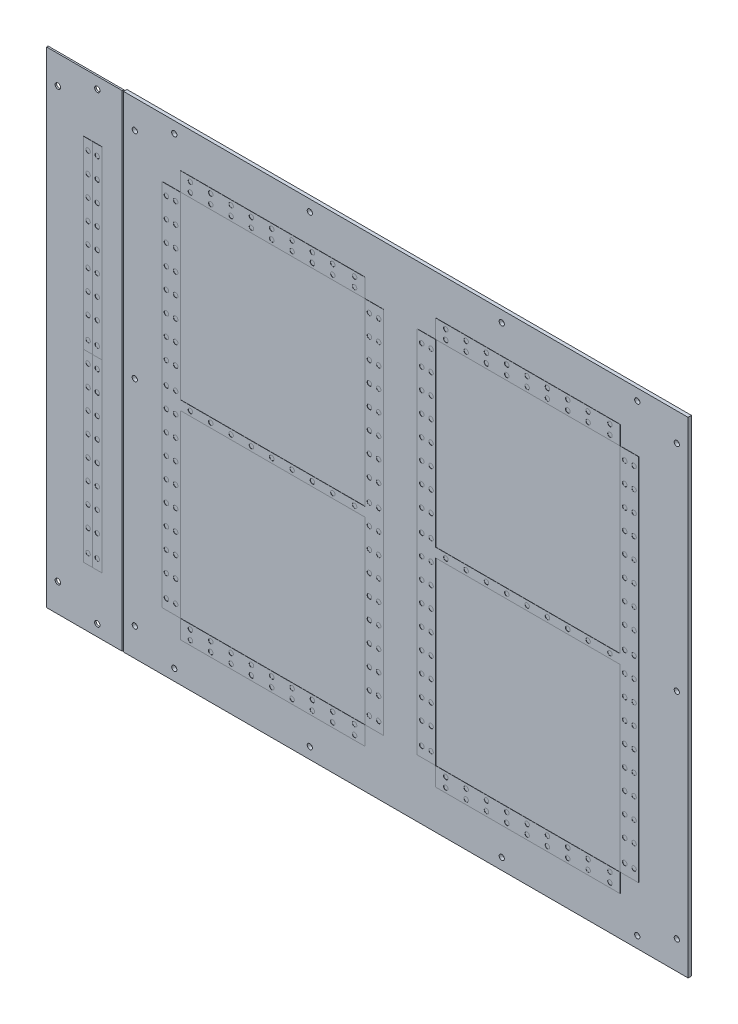
from build123d import *

# Parameters (mm, degrees)
ESBO_O4_W                        = 500
ESBO_O4_H                        = 430
FLANGE_BASE1_DEPTH               = 3
ESBO_O6_W                        = 67
ESBO_O6_H                        = 430
FLANGE_BASE2_DEPTH               = 1.4
ESBO_O9_R                        = 2.4
CORTE_EXTRUS_O2_DEPTH            = 10
RESSALTO_EXTRUS_O1_OUTLINE_W     = 8.2
RESSALTO_EXTRUS_O1_OUTLINE_H     = 163.357552272
RESSALTO_EXTRUS_O1_OUTLINE_R     = 2
RESSALTO_EXTRUS_O1_DEPTH         = 0.2
RESSALTO_EXTRUS_O1_2_OUTLINE_W   = 8.2
RESSALTO_EXTRUS_O1_2_OUTLINE_H   = 163.357552271
RESSALTO_EXTRUS_O1_2_OUTLINE_R   = 2
RESSALTO_EXTRUS_O1_2_DEPTH       = 0.2
RESSALTO_EXTRUS_O1_3_OUTLINE_W   = 8.2
RESSALTO_EXTRUS_O1_3_OUTLINE_H   = 163.357552271
RESSALTO_EXTRUS_O1_3_OUTLINE_R   = 2
RESSALTO_EXTRUS_O1_3_DEPTH       = 0.2
RESSALTO_EXTRUS_O1_4_OUTLINE_W   = 8.2
RESSALTO_EXTRUS_O1_4_OUTLINE_H   = 163.357552272
RESSALTO_EXTRUS_O1_4_OUTLINE_R   = 2
RESSALTO_EXTRUS_O1_4_DEPTH       = 0.2
RESSALTO_EXTRUS_O1_5_OUTLINE_W   = 163.357552272
RESSALTO_EXTRUS_O1_5_OUTLINE_H   = 16.4
RESSALTO_EXTRUS_O1_5_OUTLINE_R   = 2
RESSALTO_EXTRUS_O1_5_OUTLINE_W_2 = 163.357552271
RESSALTO_EXTRUS_O1_5_DEPTH       = 0.2
ESBO_O13_R                       = 2.3
CORTE_EXTRUS_O3_DEPTH            = 3


with BuildPart() as part:
    # Flange-base1: sheet metal written as solids
    # Esboço4 → Flange-base1 (new body)
    with BuildSketch(Plane.XY):
        with Locations((39.157455037, 0)):
            Rectangle(ESBO_O4_W, ESBO_O4_H)
    extrude(amount=-FLANGE_BASE1_DEPTH)

    # Ressalto-extrus_o1 5 outline → Ressalto-extrus_o1 5 (add)
    # profile 1 of 6: a face of its own
    with BuildSketch(Plane.XY):
        with Locations((-78.655821477, -171.990181002)):
            Rectangle(RESSALTO_EXTRUS_O1_5_OUTLINE_W, RESSALTO_EXTRUS_O1_5_OUTLINE_H)
        with Locations((-151.334597613, -176.090181002)):
            Circle(RESSALTO_EXTRUS_O1_5_OUTLINE_R, mode=Mode.SUBTRACT)
        with Locations((-151.334597613, -167.890181002)):
            Circle(RESSALTO_EXTRUS_O1_5_OUTLINE_R, mode=Mode.SUBTRACT)
        with Locations((-133.334597613, -176.090181002)):
            Circle(RESSALTO_EXTRUS_O1_5_OUTLINE_R, mode=Mode.SUBTRACT)
        with Locations((-133.334597613, -167.890181002)):
            Circle(RESSALTO_EXTRUS_O1_5_OUTLINE_R, mode=Mode.SUBTRACT)
        with Locations((-115.334597613, -176.090181002)):
            Circle(RESSALTO_EXTRUS_O1_5_OUTLINE_R, mode=Mode.SUBTRACT)
        with Locations((-115.334597613, -167.890181002)):
            Circle(RESSALTO_EXTRUS_O1_5_OUTLINE_R, mode=Mode.SUBTRACT)
        with Locations((-97.334597613, -176.090181002)):
            Circle(RESSALTO_EXTRUS_O1_5_OUTLINE_R, mode=Mode.SUBTRACT)
        with Locations((-79.334597613, -176.090181002)):
            Circle(RESSALTO_EXTRUS_O1_5_OUTLINE_R, mode=Mode.SUBTRACT)
        with Locations((-97.334597613, -167.890181002)):
            Circle(RESSALTO_EXTRUS_O1_5_OUTLINE_R, mode=Mode.SUBTRACT)
        with Locations((-79.334597613, -167.890181002)):
            Circle(RESSALTO_EXTRUS_O1_5_OUTLINE_R, mode=Mode.SUBTRACT)
        with Locations((-61.334597613, -176.090181002)):
            Circle(RESSALTO_EXTRUS_O1_5_OUTLINE_R, mode=Mode.SUBTRACT)
        with Locations((-61.334597613, -167.890181002)):
            Circle(RESSALTO_EXTRUS_O1_5_OUTLINE_R, mode=Mode.SUBTRACT)
        with Locations((-43.334597613, -176.090181002)):
            Circle(RESSALTO_EXTRUS_O1_5_OUTLINE_R, mode=Mode.SUBTRACT)
        with Locations((-25.334597613, -176.090181002)):
            Circle(RESSALTO_EXTRUS_O1_5_OUTLINE_R, mode=Mode.SUBTRACT)
        with Locations((-43.334597613, -167.890181002)):
            Circle(RESSALTO_EXTRUS_O1_5_OUTLINE_R, mode=Mode.SUBTRACT)
        with Locations((-25.334597613, -167.890181002)):
            Circle(RESSALTO_EXTRUS_O1_5_OUTLINE_R, mode=Mode.SUBTRACT)
        with Locations((-5.977045341, -176.090181002)):
            Circle(RESSALTO_EXTRUS_O1_5_OUTLINE_R, mode=Mode.SUBTRACT)
        with Locations((-5.977045341, -167.890181002)):
            Circle(RESSALTO_EXTRUS_O1_5_OUTLINE_R, mode=Mode.SUBTRACT)
    # profile 2 of 6: a face of its own
    with BuildSketch(Plane.XY):
        with Locations((147.501730795, -171.990181002)):
            Rectangle(RESSALTO_EXTRUS_O1_5_OUTLINE_W_2, RESSALTO_EXTRUS_O1_5_OUTLINE_H)
        with Locations((74.822954659, -176.090181002)):
            Circle(RESSALTO_EXTRUS_O1_5_OUTLINE_R, mode=Mode.SUBTRACT)
        with Locations((74.822954659, -167.890181002)):
            Circle(RESSALTO_EXTRUS_O1_5_OUTLINE_R, mode=Mode.SUBTRACT)
        with Locations((92.822954659, -176.090181002)):
            Circle(RESSALTO_EXTRUS_O1_5_OUTLINE_R, mode=Mode.SUBTRACT)
        with Locations((110.822954659, -176.090181002)):
            Circle(RESSALTO_EXTRUS_O1_5_OUTLINE_R, mode=Mode.SUBTRACT)
        with Locations((92.822954659, -167.890181002)):
            Circle(RESSALTO_EXTRUS_O1_5_OUTLINE_R, mode=Mode.SUBTRACT)
        with Locations((110.822954659, -167.890181002)):
            Circle(RESSALTO_EXTRUS_O1_5_OUTLINE_R, mode=Mode.SUBTRACT)
        with Locations((128.822954659, -176.090181002)):
            Circle(RESSALTO_EXTRUS_O1_5_OUTLINE_R, mode=Mode.SUBTRACT)
        with Locations((128.822954659, -167.890181002)):
            Circle(RESSALTO_EXTRUS_O1_5_OUTLINE_R, mode=Mode.SUBTRACT)
        with Locations((146.822954659, -176.090181002)):
            Circle(RESSALTO_EXTRUS_O1_5_OUTLINE_R, mode=Mode.SUBTRACT)
        with Locations((164.822954659, -176.090181002)):
            Circle(RESSALTO_EXTRUS_O1_5_OUTLINE_R, mode=Mode.SUBTRACT)
        with Locations((146.822954659, -167.890181002)):
            Circle(RESSALTO_EXTRUS_O1_5_OUTLINE_R, mode=Mode.SUBTRACT)
        with Locations((164.822954659, -167.890181002)):
            Circle(RESSALTO_EXTRUS_O1_5_OUTLINE_R, mode=Mode.SUBTRACT)
        with Locations((182.822954659, -176.090181002)):
            Circle(RESSALTO_EXTRUS_O1_5_OUTLINE_R, mode=Mode.SUBTRACT)
        with Locations((182.822954659, -167.890181002)):
            Circle(RESSALTO_EXTRUS_O1_5_OUTLINE_R, mode=Mode.SUBTRACT)
        with Locations((200.822954659, -176.090181002)):
            Circle(RESSALTO_EXTRUS_O1_5_OUTLINE_R, mode=Mode.SUBTRACT)
        with Locations((200.822954659, -167.890181002)):
            Circle(RESSALTO_EXTRUS_O1_5_OUTLINE_R, mode=Mode.SUBTRACT)
        with Locations((220.18050693, -176.090181002)):
            Circle(RESSALTO_EXTRUS_O1_5_OUTLINE_R, mode=Mode.SUBTRACT)
        with Locations((220.18050693, -167.890181002)):
            Circle(RESSALTO_EXTRUS_O1_5_OUTLINE_R, mode=Mode.SUBTRACT)
    # profile 3 of 6: a face of its own
    with BuildSketch(Plane.XY):
        Polygon((3.022954659, 3.787927443), (-160.334597613, 3.787927443), (-160.334597613, 163.045479714), (-176.734597613, 163.045479714), (-176.734597613, -163.669624829), (-160.334597613, -163.669624829), (-160.334597613, -4.412072557), (3.022954659, -4.412072557), (3.022954659, -163.669624829), (19.422954659, -163.669624829), (19.422954659, 163.045479714), (3.022954659, 163.045479714), align=None)
        with Locations((-172.634597613, -154.669624829)):
            Circle(RESSALTO_EXTRUS_O1_5_OUTLINE_R, mode=Mode.SUBTRACT)
        with Locations((-164.434597613, -154.669624829)):
            Circle(RESSALTO_EXTRUS_O1_5_OUTLINE_R, mode=Mode.SUBTRACT)
        with Locations((-172.634597613, -135.312072557)):
            Circle(RESSALTO_EXTRUS_O1_5_OUTLINE_R, mode=Mode.SUBTRACT)
        with Locations((-164.434597613, -135.312072557)):
            Circle(RESSALTO_EXTRUS_O1_5_OUTLINE_R, mode=Mode.SUBTRACT)
        with Locations((-172.634597613, -117.312072557)):
            Circle(RESSALTO_EXTRUS_O1_5_OUTLINE_R, mode=Mode.SUBTRACT)
        with Locations((-164.434597613, -117.312072557)):
            Circle(RESSALTO_EXTRUS_O1_5_OUTLINE_R, mode=Mode.SUBTRACT)
        with Locations((-172.634597613, -99.312072557)):
            Circle(RESSALTO_EXTRUS_O1_5_OUTLINE_R, mode=Mode.SUBTRACT)
        with Locations((-164.434597613, -99.312072557)):
            Circle(RESSALTO_EXTRUS_O1_5_OUTLINE_R, mode=Mode.SUBTRACT)
        with Locations((7.122954659, -154.669624829)):
            Circle(RESSALTO_EXTRUS_O1_5_OUTLINE_R, mode=Mode.SUBTRACT)
        with Locations((7.122954659, -135.312072557)):
            Circle(RESSALTO_EXTRUS_O1_5_OUTLINE_R, mode=Mode.SUBTRACT)
        with Locations((15.322954659, -154.669624829)):
            Circle(RESSALTO_EXTRUS_O1_5_OUTLINE_R, mode=Mode.SUBTRACT)
        with Locations((15.322954659, -135.312072557)):
            Circle(RESSALTO_EXTRUS_O1_5_OUTLINE_R, mode=Mode.SUBTRACT)
        with Locations((7.122954659, -117.312072557)):
            Circle(RESSALTO_EXTRUS_O1_5_OUTLINE_R, mode=Mode.SUBTRACT)
        with Locations((15.322954659, -117.312072557)):
            Circle(RESSALTO_EXTRUS_O1_5_OUTLINE_R, mode=Mode.SUBTRACT)
        with Locations((7.122954659, -99.312072557)):
            Circle(RESSALTO_EXTRUS_O1_5_OUTLINE_R, mode=Mode.SUBTRACT)
        with Locations((15.322954659, -99.312072557)):
            Circle(RESSALTO_EXTRUS_O1_5_OUTLINE_R, mode=Mode.SUBTRACT)
        with Locations((-172.634597613, -81.312072557)):
            Circle(RESSALTO_EXTRUS_O1_5_OUTLINE_R, mode=Mode.SUBTRACT)
        with Locations((-164.434597613, -81.312072557)):
            Circle(RESSALTO_EXTRUS_O1_5_OUTLINE_R, mode=Mode.SUBTRACT)
        with Locations((-172.634597613, -63.312072557)):
            Circle(RESSALTO_EXTRUS_O1_5_OUTLINE_R, mode=Mode.SUBTRACT)
        with Locations((-164.434597613, -63.312072557)):
            Circle(RESSALTO_EXTRUS_O1_5_OUTLINE_R, mode=Mode.SUBTRACT)
        with Locations((-172.634597613, -45.312072557)):
            Circle(RESSALTO_EXTRUS_O1_5_OUTLINE_R, mode=Mode.SUBTRACT)
        with Locations((-164.434597613, -45.312072557)):
            Circle(RESSALTO_EXTRUS_O1_5_OUTLINE_R, mode=Mode.SUBTRACT)
        with Locations((-172.634597613, -27.312072557)):
            Circle(RESSALTO_EXTRUS_O1_5_OUTLINE_R, mode=Mode.SUBTRACT)
        with Locations((-164.434597613, -27.312072557)):
            Circle(RESSALTO_EXTRUS_O1_5_OUTLINE_R, mode=Mode.SUBTRACT)
        with Locations((-172.634597613, -9.312072557)):
            Circle(RESSALTO_EXTRUS_O1_5_OUTLINE_R, mode=Mode.SUBTRACT)
        with Locations((-164.434597613, -9.312072557)):
            Circle(RESSALTO_EXTRUS_O1_5_OUTLINE_R, mode=Mode.SUBTRACT)
        with Locations((-151.334597613, -0.312072557)):
            Circle(RESSALTO_EXTRUS_O1_5_OUTLINE_R, mode=Mode.SUBTRACT)
        with Locations((-133.334597613, -0.312072557)):
            Circle(RESSALTO_EXTRUS_O1_5_OUTLINE_R, mode=Mode.SUBTRACT)
        with Locations((-115.334597613, -0.312072557)):
            Circle(RESSALTO_EXTRUS_O1_5_OUTLINE_R, mode=Mode.SUBTRACT)
        with Locations((-97.334597613, -0.312072557)):
            Circle(RESSALTO_EXTRUS_O1_5_OUTLINE_R, mode=Mode.SUBTRACT)
        with Locations((-79.334597613, -0.312072557)):
            Circle(RESSALTO_EXTRUS_O1_5_OUTLINE_R, mode=Mode.SUBTRACT)
        with Locations((7.122954659, -81.312072557)):
            Circle(RESSALTO_EXTRUS_O1_5_OUTLINE_R, mode=Mode.SUBTRACT)
        with Locations((15.322954659, -81.312072557)):
            Circle(RESSALTO_EXTRUS_O1_5_OUTLINE_R, mode=Mode.SUBTRACT)
        with Locations((7.122954659, -63.312072557)):
            Circle(RESSALTO_EXTRUS_O1_5_OUTLINE_R, mode=Mode.SUBTRACT)
        with Locations((7.122954659, -45.312072557)):
            Circle(RESSALTO_EXTRUS_O1_5_OUTLINE_R, mode=Mode.SUBTRACT)
        with Locations((15.322954659, -63.312072557)):
            Circle(RESSALTO_EXTRUS_O1_5_OUTLINE_R, mode=Mode.SUBTRACT)
        with Locations((15.322954659, -45.312072557)):
            Circle(RESSALTO_EXTRUS_O1_5_OUTLINE_R, mode=Mode.SUBTRACT)
        with Locations((-61.334597613, -0.312072557)):
            Circle(RESSALTO_EXTRUS_O1_5_OUTLINE_R, mode=Mode.SUBTRACT)
        with Locations((-43.334597613, -0.312072557)):
            Circle(RESSALTO_EXTRUS_O1_5_OUTLINE_R, mode=Mode.SUBTRACT)
        with Locations((-25.334597613, -0.312072557)):
            Circle(RESSALTO_EXTRUS_O1_5_OUTLINE_R, mode=Mode.SUBTRACT)
        with Locations((7.122954659, -27.312072557)):
            Circle(RESSALTO_EXTRUS_O1_5_OUTLINE_R, mode=Mode.SUBTRACT)
        with Locations((15.322954659, -27.312072557)):
            Circle(RESSALTO_EXTRUS_O1_5_OUTLINE_R, mode=Mode.SUBTRACT)
        with Locations((-5.977045341, -0.312072557)):
            Circle(RESSALTO_EXTRUS_O1_5_OUTLINE_R, mode=Mode.SUBTRACT)
        with Locations((7.122954659, -9.312072557)):
            Circle(RESSALTO_EXTRUS_O1_5_OUTLINE_R, mode=Mode.SUBTRACT)
        with Locations((15.322954659, -9.312072557)):
            Circle(RESSALTO_EXTRUS_O1_5_OUTLINE_R, mode=Mode.SUBTRACT)
        with Locations((-172.634597613, 8.687927443)):
            Circle(RESSALTO_EXTRUS_O1_5_OUTLINE_R, mode=Mode.SUBTRACT)
        with Locations((-164.434597613, 8.687927443)):
            Circle(RESSALTO_EXTRUS_O1_5_OUTLINE_R, mode=Mode.SUBTRACT)
        with Locations((-172.634597613, 28.045479714)):
            Circle(RESSALTO_EXTRUS_O1_5_OUTLINE_R, mode=Mode.SUBTRACT)
        with Locations((-164.434597613, 28.045479714)):
            Circle(RESSALTO_EXTRUS_O1_5_OUTLINE_R, mode=Mode.SUBTRACT)
        with Locations((-172.634597613, 46.045479714)):
            Circle(RESSALTO_EXTRUS_O1_5_OUTLINE_R, mode=Mode.SUBTRACT)
        with Locations((-164.434597613, 46.045479714)):
            Circle(RESSALTO_EXTRUS_O1_5_OUTLINE_R, mode=Mode.SUBTRACT)
        with Locations((-172.634597613, 64.045479714)):
            Circle(RESSALTO_EXTRUS_O1_5_OUTLINE_R, mode=Mode.SUBTRACT)
        with Locations((-164.434597613, 64.045479714)):
            Circle(RESSALTO_EXTRUS_O1_5_OUTLINE_R, mode=Mode.SUBTRACT)
        with Locations((-172.634597613, 82.045479714)):
            Circle(RESSALTO_EXTRUS_O1_5_OUTLINE_R, mode=Mode.SUBTRACT)
        with Locations((-164.434597613, 82.045479714)):
            Circle(RESSALTO_EXTRUS_O1_5_OUTLINE_R, mode=Mode.SUBTRACT)
        with Locations((7.122954659, 8.687927443)):
            Circle(RESSALTO_EXTRUS_O1_5_OUTLINE_R, mode=Mode.SUBTRACT)
        with Locations((15.322954659, 8.687927443)):
            Circle(RESSALTO_EXTRUS_O1_5_OUTLINE_R, mode=Mode.SUBTRACT)
        with Locations((7.122954659, 28.045479714)):
            Circle(RESSALTO_EXTRUS_O1_5_OUTLINE_R, mode=Mode.SUBTRACT)
        with Locations((15.322954659, 28.045479714)):
            Circle(RESSALTO_EXTRUS_O1_5_OUTLINE_R, mode=Mode.SUBTRACT)
        with Locations((7.122954659, 46.045479714)):
            Circle(RESSALTO_EXTRUS_O1_5_OUTLINE_R, mode=Mode.SUBTRACT)
        with Locations((7.122954659, 64.045479714)):
            Circle(RESSALTO_EXTRUS_O1_5_OUTLINE_R, mode=Mode.SUBTRACT)
        with Locations((15.322954659, 46.045479714)):
            Circle(RESSALTO_EXTRUS_O1_5_OUTLINE_R, mode=Mode.SUBTRACT)
        with Locations((15.322954659, 64.045479714)):
            Circle(RESSALTO_EXTRUS_O1_5_OUTLINE_R, mode=Mode.SUBTRACT)
        with Locations((7.122954659, 82.045479714)):
            Circle(RESSALTO_EXTRUS_O1_5_OUTLINE_R, mode=Mode.SUBTRACT)
        with Locations((15.322954659, 82.045479714)):
            Circle(RESSALTO_EXTRUS_O1_5_OUTLINE_R, mode=Mode.SUBTRACT)
        with Locations((-172.634597613, 100.045479714)):
            Circle(RESSALTO_EXTRUS_O1_5_OUTLINE_R, mode=Mode.SUBTRACT)
        with Locations((-164.434597613, 100.045479714)):
            Circle(RESSALTO_EXTRUS_O1_5_OUTLINE_R, mode=Mode.SUBTRACT)
        with Locations((-172.634597613, 118.045479714)):
            Circle(RESSALTO_EXTRUS_O1_5_OUTLINE_R, mode=Mode.SUBTRACT)
        with Locations((-164.434597613, 118.045479714)):
            Circle(RESSALTO_EXTRUS_O1_5_OUTLINE_R, mode=Mode.SUBTRACT)
        with Locations((-172.634597613, 136.045479714)):
            Circle(RESSALTO_EXTRUS_O1_5_OUTLINE_R, mode=Mode.SUBTRACT)
        with Locations((-164.434597613, 136.045479714)):
            Circle(RESSALTO_EXTRUS_O1_5_OUTLINE_R, mode=Mode.SUBTRACT)
        with Locations((-172.634597613, 154.045479714)):
            Circle(RESSALTO_EXTRUS_O1_5_OUTLINE_R, mode=Mode.SUBTRACT)
        with Locations((-164.434597613, 154.045479714)):
            Circle(RESSALTO_EXTRUS_O1_5_OUTLINE_R, mode=Mode.SUBTRACT)
        with Locations((7.122954659, 100.045479714)):
            Circle(RESSALTO_EXTRUS_O1_5_OUTLINE_R, mode=Mode.SUBTRACT)
        with Locations((15.322954659, 100.045479714)):
            Circle(RESSALTO_EXTRUS_O1_5_OUTLINE_R, mode=Mode.SUBTRACT)
        with Locations((7.122954659, 118.045479714)):
            Circle(RESSALTO_EXTRUS_O1_5_OUTLINE_R, mode=Mode.SUBTRACT)
        with Locations((15.322954659, 118.045479714)):
            Circle(RESSALTO_EXTRUS_O1_5_OUTLINE_R, mode=Mode.SUBTRACT)
        with Locations((7.122954659, 136.045479714)):
            Circle(RESSALTO_EXTRUS_O1_5_OUTLINE_R, mode=Mode.SUBTRACT)
        with Locations((7.122954659, 154.045479714)):
            Circle(RESSALTO_EXTRUS_O1_5_OUTLINE_R, mode=Mode.SUBTRACT)
        with Locations((15.322954659, 136.045479714)):
            Circle(RESSALTO_EXTRUS_O1_5_OUTLINE_R, mode=Mode.SUBTRACT)
        with Locations((15.322954659, 154.045479714)):
            Circle(RESSALTO_EXTRUS_O1_5_OUTLINE_R, mode=Mode.SUBTRACT)
    # profile 4 of 6: a face of its own
    with BuildSketch(Plane.XY):
        Polygon((229.18050693, 3.787927443), (65.822954659, 3.787927443), (65.822954659, 163.045479714), (49.422954659, 163.045479714), (49.422954659, -163.669624829), (65.822954659, -163.669624829), (65.822954659, -4.412072557), (229.18050693, -4.412072557), (229.18050693, -163.669624829), (245.58050693, -163.669624829), (245.58050693, 163.045479714), (229.18050693, 163.045479714), align=None)
        with Locations((53.522954659, -154.669624829)):
            Circle(RESSALTO_EXTRUS_O1_5_OUTLINE_R, mode=Mode.SUBTRACT)
        with Locations((53.522954659, -135.312072557)):
            Circle(RESSALTO_EXTRUS_O1_5_OUTLINE_R, mode=Mode.SUBTRACT)
        with Locations((61.722954659, -154.669624829)):
            Circle(RESSALTO_EXTRUS_O1_5_OUTLINE_R, mode=Mode.SUBTRACT)
        with Locations((61.722954659, -135.312072557)):
            Circle(RESSALTO_EXTRUS_O1_5_OUTLINE_R, mode=Mode.SUBTRACT)
        with Locations((53.522954659, -117.312072557)):
            Circle(RESSALTO_EXTRUS_O1_5_OUTLINE_R, mode=Mode.SUBTRACT)
        with Locations((61.722954659, -117.312072557)):
            Circle(RESSALTO_EXTRUS_O1_5_OUTLINE_R, mode=Mode.SUBTRACT)
        with Locations((53.522954659, -99.312072557)):
            Circle(RESSALTO_EXTRUS_O1_5_OUTLINE_R, mode=Mode.SUBTRACT)
        with Locations((61.722954659, -99.312072557)):
            Circle(RESSALTO_EXTRUS_O1_5_OUTLINE_R, mode=Mode.SUBTRACT)
        with Locations((233.28050693, -154.669624829)):
            Circle(RESSALTO_EXTRUS_O1_5_OUTLINE_R, mode=Mode.SUBTRACT)
        with Locations((241.48050693, -154.669624829)):
            Circle(RESSALTO_EXTRUS_O1_5_OUTLINE_R, mode=Mode.SUBTRACT)
        with Locations((233.28050693, -135.312072557)):
            Circle(RESSALTO_EXTRUS_O1_5_OUTLINE_R, mode=Mode.SUBTRACT)
        with Locations((241.48050693, -135.312072557)):
            Circle(RESSALTO_EXTRUS_O1_5_OUTLINE_R, mode=Mode.SUBTRACT)
        with Locations((233.28050693, -117.312072557)):
            Circle(RESSALTO_EXTRUS_O1_5_OUTLINE_R, mode=Mode.SUBTRACT)
        with Locations((241.48050693, -117.312072557)):
            Circle(RESSALTO_EXTRUS_O1_5_OUTLINE_R, mode=Mode.SUBTRACT)
        with Locations((233.28050693, -99.312072557)):
            Circle(RESSALTO_EXTRUS_O1_5_OUTLINE_R, mode=Mode.SUBTRACT)
        with Locations((241.48050693, -99.312072557)):
            Circle(RESSALTO_EXTRUS_O1_5_OUTLINE_R, mode=Mode.SUBTRACT)
        with Locations((53.522954659, -81.312072557)):
            Circle(RESSALTO_EXTRUS_O1_5_OUTLINE_R, mode=Mode.SUBTRACT)
        with Locations((61.722954659, -81.312072557)):
            Circle(RESSALTO_EXTRUS_O1_5_OUTLINE_R, mode=Mode.SUBTRACT)
        with Locations((53.522954659, -63.312072557)):
            Circle(RESSALTO_EXTRUS_O1_5_OUTLINE_R, mode=Mode.SUBTRACT)
        with Locations((53.522954659, -45.312072557)):
            Circle(RESSALTO_EXTRUS_O1_5_OUTLINE_R, mode=Mode.SUBTRACT)
        with Locations((61.722954659, -63.312072557)):
            Circle(RESSALTO_EXTRUS_O1_5_OUTLINE_R, mode=Mode.SUBTRACT)
        with Locations((61.722954659, -45.312072557)):
            Circle(RESSALTO_EXTRUS_O1_5_OUTLINE_R, mode=Mode.SUBTRACT)
        with Locations((53.522954659, -27.312072557)):
            Circle(RESSALTO_EXTRUS_O1_5_OUTLINE_R, mode=Mode.SUBTRACT)
        with Locations((61.722954659, -27.312072557)):
            Circle(RESSALTO_EXTRUS_O1_5_OUTLINE_R, mode=Mode.SUBTRACT)
        with Locations((53.522954659, -9.312072557)):
            Circle(RESSALTO_EXTRUS_O1_5_OUTLINE_R, mode=Mode.SUBTRACT)
        with Locations((61.722954659, -9.312072557)):
            Circle(RESSALTO_EXTRUS_O1_5_OUTLINE_R, mode=Mode.SUBTRACT)
        with Locations((74.822954659, -0.312072557)):
            Circle(RESSALTO_EXTRUS_O1_5_OUTLINE_R, mode=Mode.SUBTRACT)
        with Locations((92.822954659, -0.312072557)):
            Circle(RESSALTO_EXTRUS_O1_5_OUTLINE_R, mode=Mode.SUBTRACT)
        with Locations((110.822954659, -0.312072557)):
            Circle(RESSALTO_EXTRUS_O1_5_OUTLINE_R, mode=Mode.SUBTRACT)
        with Locations((128.822954659, -0.312072557)):
            Circle(RESSALTO_EXTRUS_O1_5_OUTLINE_R, mode=Mode.SUBTRACT)
        with Locations((233.28050693, -81.312072557)):
            Circle(RESSALTO_EXTRUS_O1_5_OUTLINE_R, mode=Mode.SUBTRACT)
        with Locations((241.48050693, -81.312072557)):
            Circle(RESSALTO_EXTRUS_O1_5_OUTLINE_R, mode=Mode.SUBTRACT)
        with Locations((233.28050693, -63.312072557)):
            Circle(RESSALTO_EXTRUS_O1_5_OUTLINE_R, mode=Mode.SUBTRACT)
        with Locations((241.48050693, -63.312072557)):
            Circle(RESSALTO_EXTRUS_O1_5_OUTLINE_R, mode=Mode.SUBTRACT)
        with Locations((233.28050693, -45.312072557)):
            Circle(RESSALTO_EXTRUS_O1_5_OUTLINE_R, mode=Mode.SUBTRACT)
        with Locations((241.48050693, -45.312072557)):
            Circle(RESSALTO_EXTRUS_O1_5_OUTLINE_R, mode=Mode.SUBTRACT)
        with Locations((146.822954659, -0.312072557)):
            Circle(RESSALTO_EXTRUS_O1_5_OUTLINE_R, mode=Mode.SUBTRACT)
        with Locations((164.822954659, -0.312072557)):
            Circle(RESSALTO_EXTRUS_O1_5_OUTLINE_R, mode=Mode.SUBTRACT)
        with Locations((182.822954659, -0.312072557)):
            Circle(RESSALTO_EXTRUS_O1_5_OUTLINE_R, mode=Mode.SUBTRACT)
        with Locations((233.28050693, -27.312072557)):
            Circle(RESSALTO_EXTRUS_O1_5_OUTLINE_R, mode=Mode.SUBTRACT)
        with Locations((241.48050693, -27.312072557)):
            Circle(RESSALTO_EXTRUS_O1_5_OUTLINE_R, mode=Mode.SUBTRACT)
        with Locations((200.822954659, -0.312072557)):
            Circle(RESSALTO_EXTRUS_O1_5_OUTLINE_R, mode=Mode.SUBTRACT)
        with Locations((220.18050693, -0.312072557)):
            Circle(RESSALTO_EXTRUS_O1_5_OUTLINE_R, mode=Mode.SUBTRACT)
        with Locations((233.28050693, -9.312072557)):
            Circle(RESSALTO_EXTRUS_O1_5_OUTLINE_R, mode=Mode.SUBTRACT)
        with Locations((241.48050693, -9.312072557)):
            Circle(RESSALTO_EXTRUS_O1_5_OUTLINE_R, mode=Mode.SUBTRACT)
        with Locations((53.522954659, 8.687927443)):
            Circle(RESSALTO_EXTRUS_O1_5_OUTLINE_R, mode=Mode.SUBTRACT)
        with Locations((61.722954659, 8.687927443)):
            Circle(RESSALTO_EXTRUS_O1_5_OUTLINE_R, mode=Mode.SUBTRACT)
        with Locations((53.522954659, 28.045479714)):
            Circle(RESSALTO_EXTRUS_O1_5_OUTLINE_R, mode=Mode.SUBTRACT)
        with Locations((61.722954659, 28.045479714)):
            Circle(RESSALTO_EXTRUS_O1_5_OUTLINE_R, mode=Mode.SUBTRACT)
        with Locations((53.522954659, 46.045479714)):
            Circle(RESSALTO_EXTRUS_O1_5_OUTLINE_R, mode=Mode.SUBTRACT)
        with Locations((53.522954659, 64.045479714)):
            Circle(RESSALTO_EXTRUS_O1_5_OUTLINE_R, mode=Mode.SUBTRACT)
        with Locations((61.722954659, 46.045479714)):
            Circle(RESSALTO_EXTRUS_O1_5_OUTLINE_R, mode=Mode.SUBTRACT)
        with Locations((61.722954659, 64.045479714)):
            Circle(RESSALTO_EXTRUS_O1_5_OUTLINE_R, mode=Mode.SUBTRACT)
        with Locations((53.522954659, 82.045479714)):
            Circle(RESSALTO_EXTRUS_O1_5_OUTLINE_R, mode=Mode.SUBTRACT)
        with Locations((61.722954659, 82.045479714)):
            Circle(RESSALTO_EXTRUS_O1_5_OUTLINE_R, mode=Mode.SUBTRACT)
        with Locations((233.28050693, 8.687927443)):
            Circle(RESSALTO_EXTRUS_O1_5_OUTLINE_R, mode=Mode.SUBTRACT)
        with Locations((241.48050693, 8.687927443)):
            Circle(RESSALTO_EXTRUS_O1_5_OUTLINE_R, mode=Mode.SUBTRACT)
        with Locations((233.28050693, 28.045479714)):
            Circle(RESSALTO_EXTRUS_O1_5_OUTLINE_R, mode=Mode.SUBTRACT)
        with Locations((241.48050693, 28.045479714)):
            Circle(RESSALTO_EXTRUS_O1_5_OUTLINE_R, mode=Mode.SUBTRACT)
        with Locations((233.28050693, 46.045479714)):
            Circle(RESSALTO_EXTRUS_O1_5_OUTLINE_R, mode=Mode.SUBTRACT)
        with Locations((241.48050693, 46.045479714)):
            Circle(RESSALTO_EXTRUS_O1_5_OUTLINE_R, mode=Mode.SUBTRACT)
        with Locations((233.28050693, 64.045479714)):
            Circle(RESSALTO_EXTRUS_O1_5_OUTLINE_R, mode=Mode.SUBTRACT)
        with Locations((241.48050693, 64.045479714)):
            Circle(RESSALTO_EXTRUS_O1_5_OUTLINE_R, mode=Mode.SUBTRACT)
        with Locations((233.28050693, 82.045479714)):
            Circle(RESSALTO_EXTRUS_O1_5_OUTLINE_R, mode=Mode.SUBTRACT)
        with Locations((241.48050693, 82.045479714)):
            Circle(RESSALTO_EXTRUS_O1_5_OUTLINE_R, mode=Mode.SUBTRACT)
        with Locations((53.522954659, 100.045479714)):
            Circle(RESSALTO_EXTRUS_O1_5_OUTLINE_R, mode=Mode.SUBTRACT)
        with Locations((61.722954659, 100.045479714)):
            Circle(RESSALTO_EXTRUS_O1_5_OUTLINE_R, mode=Mode.SUBTRACT)
        with Locations((53.522954659, 118.045479714)):
            Circle(RESSALTO_EXTRUS_O1_5_OUTLINE_R, mode=Mode.SUBTRACT)
        with Locations((61.722954659, 118.045479714)):
            Circle(RESSALTO_EXTRUS_O1_5_OUTLINE_R, mode=Mode.SUBTRACT)
        with Locations((53.522954659, 136.045479714)):
            Circle(RESSALTO_EXTRUS_O1_5_OUTLINE_R, mode=Mode.SUBTRACT)
        with Locations((53.522954659, 154.045479714)):
            Circle(RESSALTO_EXTRUS_O1_5_OUTLINE_R, mode=Mode.SUBTRACT)
        with Locations((61.722954659, 136.045479714)):
            Circle(RESSALTO_EXTRUS_O1_5_OUTLINE_R, mode=Mode.SUBTRACT)
        with Locations((61.722954659, 154.045479714)):
            Circle(RESSALTO_EXTRUS_O1_5_OUTLINE_R, mode=Mode.SUBTRACT)
        with Locations((233.28050693, 100.045479714)):
            Circle(RESSALTO_EXTRUS_O1_5_OUTLINE_R, mode=Mode.SUBTRACT)
        with Locations((241.48050693, 100.045479714)):
            Circle(RESSALTO_EXTRUS_O1_5_OUTLINE_R, mode=Mode.SUBTRACT)
        with Locations((233.28050693, 118.045479714)):
            Circle(RESSALTO_EXTRUS_O1_5_OUTLINE_R, mode=Mode.SUBTRACT)
        with Locations((241.48050693, 118.045479714)):
            Circle(RESSALTO_EXTRUS_O1_5_OUTLINE_R, mode=Mode.SUBTRACT)
        with Locations((233.28050693, 136.045479714)):
            Circle(RESSALTO_EXTRUS_O1_5_OUTLINE_R, mode=Mode.SUBTRACT)
        with Locations((241.48050693, 136.045479714)):
            Circle(RESSALTO_EXTRUS_O1_5_OUTLINE_R, mode=Mode.SUBTRACT)
        with Locations((233.28050693, 154.045479714)):
            Circle(RESSALTO_EXTRUS_O1_5_OUTLINE_R, mode=Mode.SUBTRACT)
        with Locations((241.48050693, 154.045479714)):
            Circle(RESSALTO_EXTRUS_O1_5_OUTLINE_R, mode=Mode.SUBTRACT)
    # profile 5 of 6: a face of its own
    with BuildSketch(Plane.XY):
        with Locations((-78.662362751, 171.378154522)):
            Rectangle(RESSALTO_EXTRUS_O1_5_OUTLINE_W_2, RESSALTO_EXTRUS_O1_5_OUTLINE_H)
        with Locations((-151.341138886, 167.278154522)):
            Circle(RESSALTO_EXTRUS_O1_5_OUTLINE_R, mode=Mode.SUBTRACT)
        with Locations((-151.341138886, 175.478154522)):
            Circle(RESSALTO_EXTRUS_O1_5_OUTLINE_R, mode=Mode.SUBTRACT)
        with Locations((-133.341138886, 167.278154522)):
            Circle(RESSALTO_EXTRUS_O1_5_OUTLINE_R, mode=Mode.SUBTRACT)
        with Locations((-133.341138886, 175.478154522)):
            Circle(RESSALTO_EXTRUS_O1_5_OUTLINE_R, mode=Mode.SUBTRACT)
        with Locations((-115.341138886, 167.278154522)):
            Circle(RESSALTO_EXTRUS_O1_5_OUTLINE_R, mode=Mode.SUBTRACT)
        with Locations((-115.341138886, 175.478154522)):
            Circle(RESSALTO_EXTRUS_O1_5_OUTLINE_R, mode=Mode.SUBTRACT)
        with Locations((-97.341138886, 167.278154522)):
            Circle(RESSALTO_EXTRUS_O1_5_OUTLINE_R, mode=Mode.SUBTRACT)
        with Locations((-79.341138886, 167.278154522)):
            Circle(RESSALTO_EXTRUS_O1_5_OUTLINE_R, mode=Mode.SUBTRACT)
        with Locations((-97.341138886, 175.478154522)):
            Circle(RESSALTO_EXTRUS_O1_5_OUTLINE_R, mode=Mode.SUBTRACT)
        with Locations((-79.341138886, 175.478154522)):
            Circle(RESSALTO_EXTRUS_O1_5_OUTLINE_R, mode=Mode.SUBTRACT)
        with Locations((-61.341138886, 167.278154522)):
            Circle(RESSALTO_EXTRUS_O1_5_OUTLINE_R, mode=Mode.SUBTRACT)
        with Locations((-61.341138886, 175.478154522)):
            Circle(RESSALTO_EXTRUS_O1_5_OUTLINE_R, mode=Mode.SUBTRACT)
        with Locations((-43.341138886, 167.278154522)):
            Circle(RESSALTO_EXTRUS_O1_5_OUTLINE_R, mode=Mode.SUBTRACT)
        with Locations((-25.341138886, 167.278154522)):
            Circle(RESSALTO_EXTRUS_O1_5_OUTLINE_R, mode=Mode.SUBTRACT)
        with Locations((-43.341138886, 175.478154522)):
            Circle(RESSALTO_EXTRUS_O1_5_OUTLINE_R, mode=Mode.SUBTRACT)
        with Locations((-25.341138886, 175.478154522)):
            Circle(RESSALTO_EXTRUS_O1_5_OUTLINE_R, mode=Mode.SUBTRACT)
        with Locations((-5.983586615, 167.278154522)):
            Circle(RESSALTO_EXTRUS_O1_5_OUTLINE_R, mode=Mode.SUBTRACT)
        with Locations((-5.983586615, 175.478154522)):
            Circle(RESSALTO_EXTRUS_O1_5_OUTLINE_R, mode=Mode.SUBTRACT)
    # profile 6 of 6: a face of its own
    with BuildSketch(Plane.XY):
        with Locations((147.495189521, 171.378154522)):
            Rectangle(RESSALTO_EXTRUS_O1_5_OUTLINE_W, RESSALTO_EXTRUS_O1_5_OUTLINE_H)
        with Locations((74.816413385, 167.278154522)):
            Circle(RESSALTO_EXTRUS_O1_5_OUTLINE_R, mode=Mode.SUBTRACT)
        with Locations((74.816413385, 175.478154522)):
            Circle(RESSALTO_EXTRUS_O1_5_OUTLINE_R, mode=Mode.SUBTRACT)
        with Locations((92.816413385, 167.278154522)):
            Circle(RESSALTO_EXTRUS_O1_5_OUTLINE_R, mode=Mode.SUBTRACT)
        with Locations((110.816413385, 167.278154522)):
            Circle(RESSALTO_EXTRUS_O1_5_OUTLINE_R, mode=Mode.SUBTRACT)
        with Locations((92.816413385, 175.478154522)):
            Circle(RESSALTO_EXTRUS_O1_5_OUTLINE_R, mode=Mode.SUBTRACT)
        with Locations((110.816413385, 175.478154522)):
            Circle(RESSALTO_EXTRUS_O1_5_OUTLINE_R, mode=Mode.SUBTRACT)
        with Locations((128.816413385, 167.278154522)):
            Circle(RESSALTO_EXTRUS_O1_5_OUTLINE_R, mode=Mode.SUBTRACT)
        with Locations((128.816413385, 175.478154522)):
            Circle(RESSALTO_EXTRUS_O1_5_OUTLINE_R, mode=Mode.SUBTRACT)
        with Locations((146.816413385, 167.278154522)):
            Circle(RESSALTO_EXTRUS_O1_5_OUTLINE_R, mode=Mode.SUBTRACT)
        with Locations((164.816413385, 167.278154522)):
            Circle(RESSALTO_EXTRUS_O1_5_OUTLINE_R, mode=Mode.SUBTRACT)
        with Locations((146.816413385, 175.478154522)):
            Circle(RESSALTO_EXTRUS_O1_5_OUTLINE_R, mode=Mode.SUBTRACT)
        with Locations((164.816413385, 175.478154522)):
            Circle(RESSALTO_EXTRUS_O1_5_OUTLINE_R, mode=Mode.SUBTRACT)
        with Locations((182.816413385, 167.278154522)):
            Circle(RESSALTO_EXTRUS_O1_5_OUTLINE_R, mode=Mode.SUBTRACT)
        with Locations((182.816413385, 175.478154522)):
            Circle(RESSALTO_EXTRUS_O1_5_OUTLINE_R, mode=Mode.SUBTRACT)
        with Locations((200.816413385, 167.278154522)):
            Circle(RESSALTO_EXTRUS_O1_5_OUTLINE_R, mode=Mode.SUBTRACT)
        with Locations((200.816413385, 175.478154522)):
            Circle(RESSALTO_EXTRUS_O1_5_OUTLINE_R, mode=Mode.SUBTRACT)
        with Locations((220.173965657, 167.278154522)):
            Circle(RESSALTO_EXTRUS_O1_5_OUTLINE_R, mode=Mode.SUBTRACT)
        with Locations((220.173965657, 175.478154522)):
            Circle(RESSALTO_EXTRUS_O1_5_OUTLINE_R, mode=Mode.SUBTRACT)
    extrude(amount=RESSALTO_EXTRUS_O1_5_DEPTH)

    # Esboço13 → Corte-extrusão3 (cut)
    with BuildSketch(Plane.XY):
        with Locations((-165.842544963, 205)):
            Circle(ESBO_O13_R)
        with Locations((-200.842544963, 190)):
            Circle(ESBO_O13_R)
        with Locations((-45.842544963, 205)):
            Circle(ESBO_O13_R)
        with Locations((-268.999342474, -0.312072557)):
            Circle(ESBO_O13_R)
        with Locations(Location((124.157455037, 205, 0), (0, 0, 180))):
            Circle(ESBO_O13_R)
        with Locations(Location((244.157455037, 205, 0), (0, 0, 180))):
            Circle(ESBO_O13_R)
        with Locations(Location((279.157455037, 190, 0), (0, 0, 180))):
            Circle(ESBO_O13_R)
        with Locations((279.157455037, -190)):
            Circle(ESBO_O13_R)
        with Locations((244.157455037, -205)):
            Circle(ESBO_O13_R)
        with Locations((124.157455037, -205)):
            Circle(ESBO_O13_R)
        with Locations(Location((-45.842544963, -205, 0), (0, 0, 180))):
            Circle(ESBO_O13_R)
        with Locations(Location((-200.842544963, -190, 0), (0, 0, 180))):
            Circle(ESBO_O13_R)
        with Locations(Location((-165.842544963, -205, 0), (0, 0, 180))):
            Circle(ESBO_O13_R)
        with Locations((240, 0)):
            Circle(ESBO_O13_R)
        with Locations((-200.842544963, -0.312072557)):
            Circle(ESBO_O13_R)
        with Locations((279.157455037, 0)):
            Circle(ESBO_O13_R)
    extrude(amount=-CORTE_EXTRUS_O3_DEPTH, mode=Mode.SUBTRACT)


with BuildPart() as body_2:
    # Flange-base2: sheet metal written as solids
    # Esboço6 → Flange-base2 (new body)
    with BuildSketch(Plane.XY):
        with Locations((-245.499342474, 0)):
            Rectangle(ESBO_O6_W, ESBO_O6_H)
    extrude(amount=-FLANGE_BASE2_DEPTH)

    # Esboço9 → Corte-extrusão2 (cut)
    with BuildSketch(Plane.XY):
        with Locations((-233.999342474, -205)):
            Circle(ESBO_O9_R)
        with Locations((-268.999342474, -190)):
            Circle(ESBO_O9_R)
        with Locations((-458.22539587, 0)):
            Circle(ESBO_O9_R)
        with Locations((-268.999342474, 190)):
            Circle(ESBO_O9_R)
        with Locations((-233.999342474, 205)):
            Circle(ESBO_O9_R)
    extrude(amount=-CORTE_EXTRUS_O2_DEPTH, mode=Mode.SUBTRACT)


with BuildPart() as body_3:
    # Ressalto-extrusão1: read off the stored shape, not the designer's step
    # Ressalto-extrusão1 outline → Ressalto-extrusão1 (new body)
    with BuildSketch(Plane.XY):
        with Locations((-242.034597613, -81.990848693)):
            Rectangle(RESSALTO_EXTRUS_O1_OUTLINE_W, RESSALTO_EXTRUS_O1_OUTLINE_H)
        with Locations((-242.034597613, -154.669624829)):
            Circle(RESSALTO_EXTRUS_O1_OUTLINE_R, mode=Mode.SUBTRACT)
        with Locations((-242.034597613, -135.312072557)):
            Circle(RESSALTO_EXTRUS_O1_OUTLINE_R, mode=Mode.SUBTRACT)
        with Locations((-242.034597613, -117.312072557)):
            Circle(RESSALTO_EXTRUS_O1_OUTLINE_R, mode=Mode.SUBTRACT)
        with Locations((-242.034597613, -99.312072557)):
            Circle(RESSALTO_EXTRUS_O1_OUTLINE_R, mode=Mode.SUBTRACT)
        with Locations((-242.034597613, -81.312072557)):
            Circle(RESSALTO_EXTRUS_O1_OUTLINE_R, mode=Mode.SUBTRACT)
        with Locations((-242.034597613, -63.312072557)):
            Circle(RESSALTO_EXTRUS_O1_OUTLINE_R, mode=Mode.SUBTRACT)
        with Locations((-242.034597613, -45.312072557)):
            Circle(RESSALTO_EXTRUS_O1_OUTLINE_R, mode=Mode.SUBTRACT)
        with Locations((-242.034597613, -27.312072557)):
            Circle(RESSALTO_EXTRUS_O1_OUTLINE_R, mode=Mode.SUBTRACT)
        with Locations((-242.034597613, -9.312072557)):
            Circle(RESSALTO_EXTRUS_O1_OUTLINE_R, mode=Mode.SUBTRACT)
    extrude(amount=RESSALTO_EXTRUS_O1_DEPTH)


with BuildPart() as body_4:
    # Ressalto-extrus_o1 2 outline → Ressalto-extrus_o1 2 (new body)
    with BuildSketch(Plane.XY):
        with Locations((-242.034597613, 81.366703579)):
            Rectangle(RESSALTO_EXTRUS_O1_2_OUTLINE_W, RESSALTO_EXTRUS_O1_2_OUTLINE_H)
        with Locations((-242.034597613, 8.687927443)):
            Circle(RESSALTO_EXTRUS_O1_2_OUTLINE_R, mode=Mode.SUBTRACT)
        with Locations((-242.034597613, 28.045479714)):
            Circle(RESSALTO_EXTRUS_O1_2_OUTLINE_R, mode=Mode.SUBTRACT)
        with Locations((-242.034597613, 46.045479714)):
            Circle(RESSALTO_EXTRUS_O1_2_OUTLINE_R, mode=Mode.SUBTRACT)
        with Locations((-242.034597613, 64.045479714)):
            Circle(RESSALTO_EXTRUS_O1_2_OUTLINE_R, mode=Mode.SUBTRACT)
        with Locations((-242.034597613, 82.045479714)):
            Circle(RESSALTO_EXTRUS_O1_2_OUTLINE_R, mode=Mode.SUBTRACT)
        with Locations((-242.034597613, 100.045479714)):
            Circle(RESSALTO_EXTRUS_O1_2_OUTLINE_R, mode=Mode.SUBTRACT)
        with Locations((-242.034597613, 118.045479714)):
            Circle(RESSALTO_EXTRUS_O1_2_OUTLINE_R, mode=Mode.SUBTRACT)
        with Locations((-242.034597613, 136.045479714)):
            Circle(RESSALTO_EXTRUS_O1_2_OUTLINE_R, mode=Mode.SUBTRACT)
        with Locations((-242.034597613, 154.045479714)):
            Circle(RESSALTO_EXTRUS_O1_2_OUTLINE_R, mode=Mode.SUBTRACT)
    extrude(amount=RESSALTO_EXTRUS_O1_2_DEPTH)


with BuildPart() as body_5:
    # Ressalto-extrus_o1 3 outline → Ressalto-extrus_o1 3 (new body)
    with BuildSketch(Plane.XY):
        with Locations((-233.834597613, 81.366703579)):
            Rectangle(RESSALTO_EXTRUS_O1_3_OUTLINE_W, RESSALTO_EXTRUS_O1_3_OUTLINE_H)
        with Locations((-233.834597613, 8.687927443)):
            Circle(RESSALTO_EXTRUS_O1_3_OUTLINE_R, mode=Mode.SUBTRACT)
        with Locations((-233.834597613, 28.045479714)):
            Circle(RESSALTO_EXTRUS_O1_3_OUTLINE_R, mode=Mode.SUBTRACT)
        with Locations((-233.834597613, 46.045479714)):
            Circle(RESSALTO_EXTRUS_O1_3_OUTLINE_R, mode=Mode.SUBTRACT)
        with Locations((-233.834597613, 64.045479714)):
            Circle(RESSALTO_EXTRUS_O1_3_OUTLINE_R, mode=Mode.SUBTRACT)
        with Locations((-233.834597613, 82.045479714)):
            Circle(RESSALTO_EXTRUS_O1_3_OUTLINE_R, mode=Mode.SUBTRACT)
        with Locations((-233.834597613, 100.045479714)):
            Circle(RESSALTO_EXTRUS_O1_3_OUTLINE_R, mode=Mode.SUBTRACT)
        with Locations((-233.834597613, 118.045479714)):
            Circle(RESSALTO_EXTRUS_O1_3_OUTLINE_R, mode=Mode.SUBTRACT)
        with Locations((-233.834597613, 136.045479714)):
            Circle(RESSALTO_EXTRUS_O1_3_OUTLINE_R, mode=Mode.SUBTRACT)
        with Locations((-233.834597613, 154.045479714)):
            Circle(RESSALTO_EXTRUS_O1_3_OUTLINE_R, mode=Mode.SUBTRACT)
    extrude(amount=RESSALTO_EXTRUS_O1_3_DEPTH)


with BuildPart() as body_6:
    # Ressalto-extrus_o1 4 outline → Ressalto-extrus_o1 4 (new body)
    with BuildSketch(Plane.XY):
        with Locations((-233.834597613, -81.990848693)):
            Rectangle(RESSALTO_EXTRUS_O1_4_OUTLINE_W, RESSALTO_EXTRUS_O1_4_OUTLINE_H)
        with Locations((-233.834597613, -154.669624829)):
            Circle(RESSALTO_EXTRUS_O1_4_OUTLINE_R, mode=Mode.SUBTRACT)
        with Locations((-233.834597613, -135.312072557)):
            Circle(RESSALTO_EXTRUS_O1_4_OUTLINE_R, mode=Mode.SUBTRACT)
        with Locations((-233.834597613, -117.312072557)):
            Circle(RESSALTO_EXTRUS_O1_4_OUTLINE_R, mode=Mode.SUBTRACT)
        with Locations((-233.834597613, -99.312072557)):
            Circle(RESSALTO_EXTRUS_O1_4_OUTLINE_R, mode=Mode.SUBTRACT)
        with Locations((-233.834597613, -81.312072557)):
            Circle(RESSALTO_EXTRUS_O1_4_OUTLINE_R, mode=Mode.SUBTRACT)
        with Locations((-233.834597613, -63.312072557)):
            Circle(RESSALTO_EXTRUS_O1_4_OUTLINE_R, mode=Mode.SUBTRACT)
        with Locations((-233.834597613, -45.312072557)):
            Circle(RESSALTO_EXTRUS_O1_4_OUTLINE_R, mode=Mode.SUBTRACT)
        with Locations((-233.834597613, -27.312072557)):
            Circle(RESSALTO_EXTRUS_O1_4_OUTLINE_R, mode=Mode.SUBTRACT)
        with Locations((-233.834597613, -9.312072557)):
            Circle(RESSALTO_EXTRUS_O1_4_OUTLINE_R, mode=Mode.SUBTRACT)
    extrude(amount=RESSALTO_EXTRUS_O1_4_DEPTH)


solid = Compound([part.part, body_2.part, body_3.part, body_4.part, body_5.part, body_6.part])
